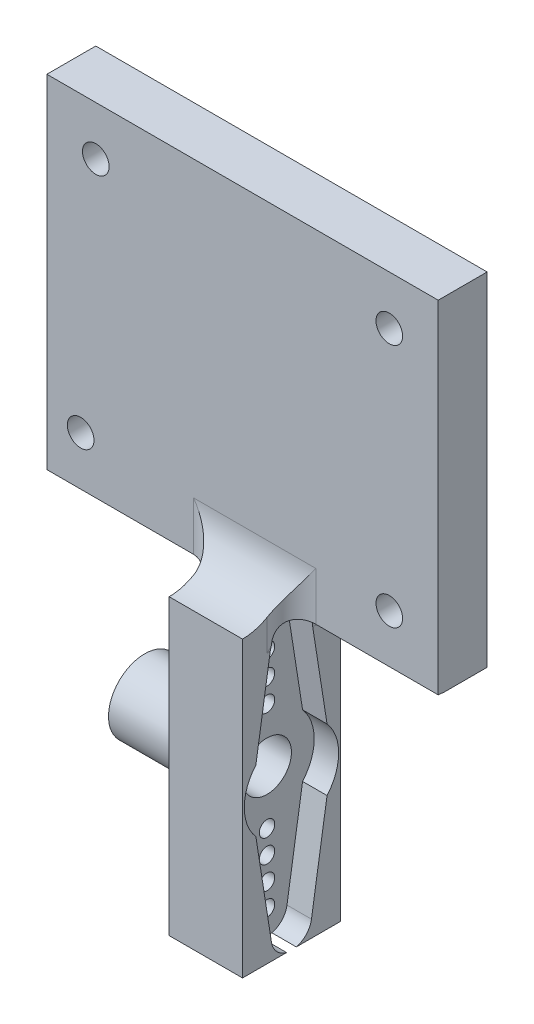
from build123d import *

# Parameters (mm, degrees)
SKETCH2_W               = 12.7
SKETCH2_H               = 38.1
SKETCH2_R               = 3.175
BOSS_EXTRUDE1_DEPTH     = 9.525
SKETCH3_R               = 4.699
BOSS_EXTRUDE2_DEPTH     = 9.525
SKETCH6_W               = 6.35
SKETCH6_H               = 44.45
BOSS_EXTRUDE3_DEPTH     = 25.4
FILLET1_R               = 6.35
FILLET4_R               = 3.175
CUT_EXTRUDE1_DEPTH      = 72.278573361
CUT_EXTRUDE1_DEPTH_BACK = 3.175
SKETCH8_R               = 1.004
CUT_EXTRUDE2_DEPTH      = 72.278573361
SKETCH9_R               = 1.726999975
CUT_EXTRUDE3_DEPTH      = 71.781852519


with BuildPart() as part:
    # Sketch2 → Boss-Extrude1 (new body)
    with BuildSketch(Plane(origin=(0, 0, 0), x_dir=(0, 0, -1), z_dir=(1, 0, 0))):
        Rectangle(SKETCH2_W, SKETCH2_H)
        with Locations(Location((0, 0, 0), (0, 0, 180))):
            Circle(SKETCH2_R, mode=Mode.SUBTRACT)
    extrude(amount=BOSS_EXTRUDE1_DEPTH)

    # Sketch3 → Boss-Extrude2 (add)
    with BuildSketch(Plane.ZY):
        with Locations(Location((0, 0, 0), (0, 0, 180))):
            Circle(SKETCH3_R)
    extrude(amount=BOSS_EXTRUDE2_DEPTH)

    # Sketch6 → Boss-Extrude3 (add, symmetric)
    with BuildSketch(Plane(origin=(3.175, 0, 0), x_dir=(0, 0, -1), z_dir=(1, 0, 0))):
        with Locations((3.175, 41.275)):
            Rectangle(SKETCH6_W, SKETCH6_H)
    extrude(amount=BOSS_EXTRUDE3_DEPTH, both=True)

    # Fillet1
    fillet1_edges = [part.edges().sort_by_distance(p)[0] for p in [
        (4.7625, 19.05, 0),
    ]]
    fillet(fillet1_edges, radius=FILLET1_R - 0.0001)  # a hair under: the kernel refuses the full size

    # Fillet4
    fillet4_edges = [part.edges().sort_by_distance(p)[0] for p in [
        (9.525, 22.22495, 0),
        (0, 22.22495, 0),
        (0, 19.05, -3.175),
        (9.525, 19.05, -3.175),
    ]]
    fillet(fillet4_edges, radius=FILLET4_R)

    # Sketch7 → Cut-Extrude1 (cut, two sides: drawn at the far end of the back side and taken through both)
    with BuildSketch(Plane(origin=(9.525, 0, 0), x_dir=(0, 0, -1), z_dir=(1, 0, 0)).offset(-CUT_EXTRUDE1_DEPTH_BACK)):
        with BuildLine():
            Line((2.595150061, -16.907830377), (4.619750173, -4.024678621))
            ThreePointArc((4.619750173, -4.024678621), (6.127000091, 2.2e-08), (4.619750173, 4.024678665))
            Line((4.619750173, 4.024678665), (2.595150061, 16.907830421))
            ThreePointArc((2.595150061, 16.907830421), (9.1e-08, 19.127000022), (-2.595149879, 16.907830421))
            Line((-2.595149879, 16.907830421), (-4.619749991, 4.024678665))
            ThreePointArc((-4.619749991, 4.024678665), (-6.126999909, 2.2e-08), (-4.619749991, -4.024678621))
            Line((-4.619749991, -4.024678621), (-2.595149879, -16.907830377))
            ThreePointArc((-2.595149879, -16.907830377), (9.1e-08, -19.126999978), (2.595150061, -16.907830377))
        make_face()
    extrude(amount=CUT_EXTRUDE1_DEPTH + CUT_EXTRUDE1_DEPTH_BACK, mode=Mode.SUBTRACT)

    # Sketch8 → Cut-Extrude2 (cut, through all)
    with BuildSketch(Plane(origin=(9.525, 0, 0), x_dir=(0, 0, -1), z_dir=(1, 0, 0))):
        with Locations((9.1e-08, -15.999999978)):
            Circle(SKETCH8_R)
        with Locations((9.1e-08, -12.999999978)):
            Circle(SKETCH8_R)
        with Locations((9.1e-08, -9.999999978)):
            Circle(SKETCH8_R)
        with Locations((9.1e-08, -6.999999978)):
            Circle(SKETCH8_R)
        with Locations((9.1e-08, 16.000000022)):
            Circle(SKETCH8_R)
        with Locations((9.1e-08, 13.000000022)):
            Circle(SKETCH8_R)
        with Locations((9.1e-08, 10.000000022)):
            Circle(SKETCH8_R)
        with Locations((9.1e-08, 7.000000022)):
            Circle(SKETCH8_R)
    extrude(amount=-CUT_EXTRUDE2_DEPTH, mode=Mode.SUBTRACT)

    # Sketch9 → Cut-Extrude3 (cut, through all)
    with BuildSketch(Plane(origin=(0, 0, -6.35), x_dir=(-1, 0, 0), z_dir=(0, 0, -1))):
        with Locations((-22.225, 57.15)):
            Circle(SKETCH9_R)
        with Locations((15.875, 57.15)):
            Circle(SKETCH9_R)
        with Locations((17.839802872, 25.4)):
            Circle(SKETCH9_R)
        with Locations((-22.225, 25.4)):
            Circle(SKETCH9_R)
    extrude(amount=-CUT_EXTRUDE3_DEPTH, mode=Mode.SUBTRACT)


solid = part.part
